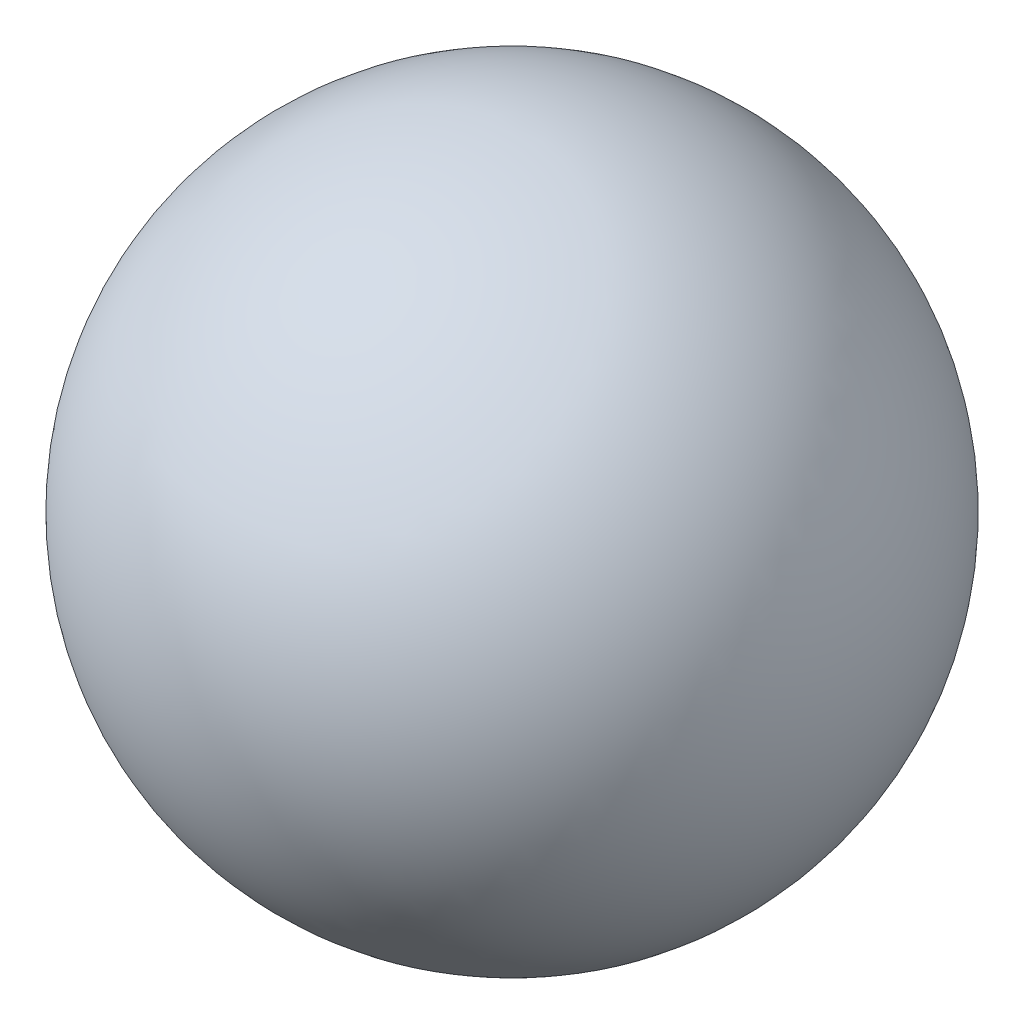
from build123d import *


with BuildPart() as part:
    # 草图1 → 旋转1 (revolve)
    with BuildSketch(Plane.XY):
        with BuildLine():
            Line((0, 299), (0, 300))
            ThreePointArc((0, 300), (300, 0), (0, -300))
            Line((0, -300), (0, -299))
            ThreePointArc((0, -299), (299, 0), (0, 299))
        make_face()
    revolve(axis=Axis((0, 300, 0), (0, -1, 0)))


solid = part.part
